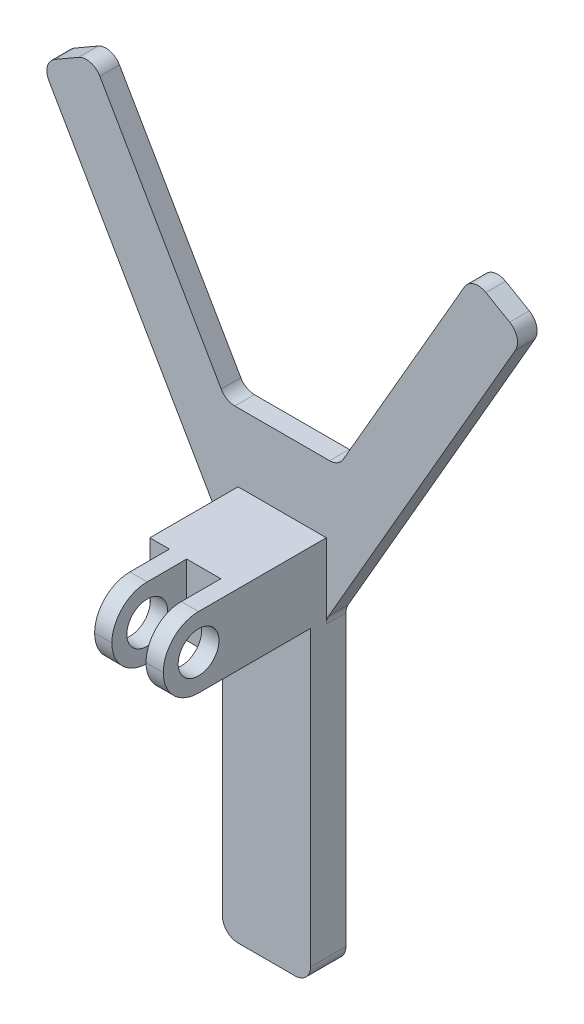
from build123d import *

# Parameters (mm, degrees)
BOSS_EXTRUDE1_DEPTH = 6.35
SKETCH3_W           = 28.575
SKETCH3_H           = 22.86
BOSS_EXTRUDE2_DEPTH = 52.8
SKETCH6_W           = 28.575
SKETCH6_H           = 100
BOSS_EXTRUDE3_DEPTH = 5.08
FILLET1_R           = 5.08
SKETCH4_W           = 6.35
SKETCH4_H           = 24.225
SKETCH4_W_2         = 11.049
CUT_EXTRUDE1_DEPTH  = 153.525464126
FILLET3_R           = 11.43
SKETCH5_R           = 6.604
CUT_EXTRUDE2_DEPTH  = 157.642486403


with BuildPart() as part:
    # Sketch1 → Boss-Extrude1 (new body)
    with BuildSketch(Plane.XY):
        Polygon((-18.271216857, 45), (18.271216857, 45), (61.572487047, 120), (78.070270989, 110.475), (14.2875, 0), (14.2875, -100), (-14.2875, -100), (-14.2875, 0), (-78.070270989, 110.475), (-61.572487047, 120), align=None)
    extrude(amount=BOSS_EXTRUDE1_DEPTH)

    # Sketch3 → Boss-Extrude2 (add)
    with BuildSketch(Plane.XY.offset(6.35)):
        with Locations((0, 11.43)):
            Rectangle(SKETCH3_W, SKETCH3_H)
    extrude(amount=BOSS_EXTRUDE2_DEPTH)

    # Sketch6 → Boss-Extrude3 (add)
    with BuildSketch(Plane.XY.offset(6.35)):
        with Locations((0, -50)):
            Rectangle(SKETCH6_W, SKETCH6_H)
    extrude(amount=BOSS_EXTRUDE3_DEPTH)

    # Fillet1
    fillet1_edges = [part.edges().sort_by_distance(p)[0] for p in [
        (-18.271216857, 45, 3.175),
        (18.271216857, 45, 3.175),
        (61.572487047, 120, 3.175),
        (78.070270989, 110.475, 3.175),
        (14.2875, 0, 3.175),
        (14.2875, -100, 5.715),
        (-14.2875, -100, 5.715),
        (-14.2875, 0, 3.175),
        (-78.070270989, 110.475, 3.175),
        (-61.572487047, 120, 3.175),
    ]]
    fillet(fillet1_edges, radius=FILLET1_R)

    # Sketch4 → Cut-Extrude1 (cut, through all)
    with BuildSketch(Plane.XZ):
        with Locations((-11.1125, 47.0375)):
            Rectangle(SKETCH4_W, SKETCH4_H)
        with Locations((3.175, 47.0375)):
            Rectangle(SKETCH4_W_2, SKETCH4_H)
    extrude(amount=-CUT_EXTRUDE1_DEPTH, mode=Mode.SUBTRACT)

    # Fillet3
    fillet3_edges = [part.edges().sort_by_distance(p)[0] for p in [
        (11.4935, 22.86, 59.15),
        (-5.1435, 22.86, 59.15),
        (11.4935, 0, 59.15),
        (-5.1435, 0, 59.15),
    ]]
    fillet(fillet3_edges, radius=FILLET3_R - 0.0001)  # a hair under: the kernel refuses the full size

    # Sketch5 → Cut-Extrude2 (cut, through all)
    with BuildSketch(Plane.ZY.offset(7.9375)):
        with Locations(Location((47.72, 11.43, 0), (0, 0, 270))):
            Circle(SKETCH5_R)
    extrude(amount=-CUT_EXTRUDE2_DEPTH, mode=Mode.SUBTRACT)


solid = part.part
